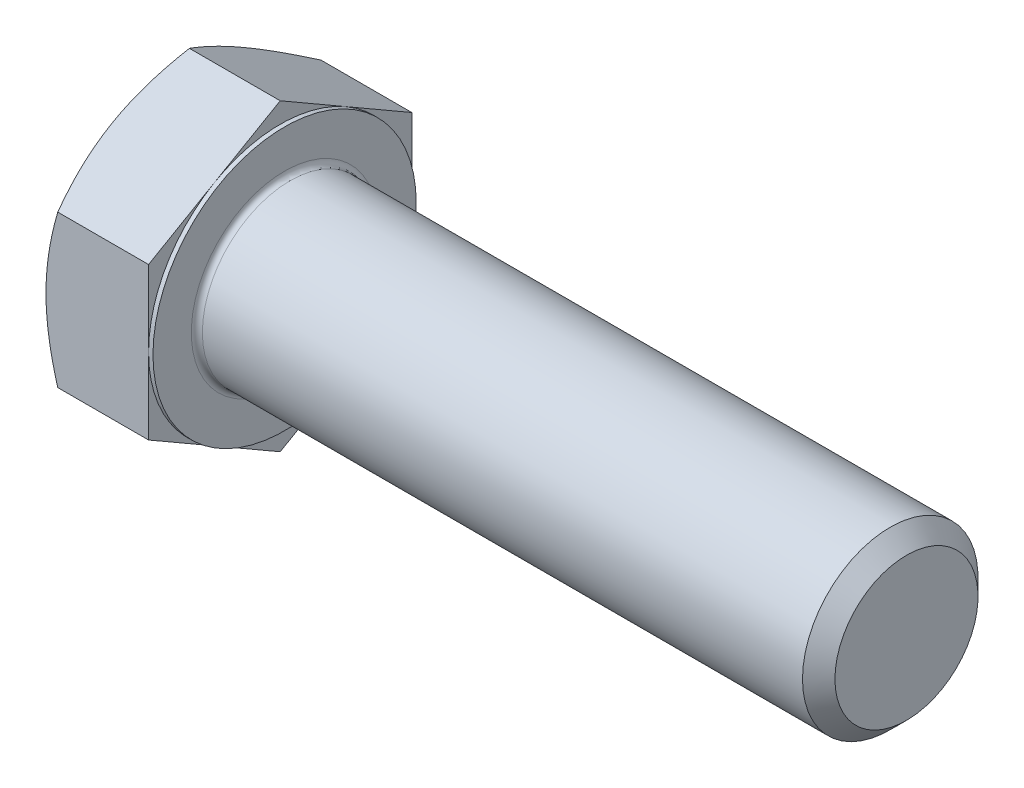
from build123d import *

# Parameters (mm, degrees)
BASEHEAD_DEPTH   = 15.478125
BEARINGFACESKE_W = 0.635
BEARINGFACESKE_H = 2.947045256
FILLET_2_R       = 0.8


with BuildPart() as part:
    # BaseHeadSke → BaseHead (new body)
    with BuildSketch(Plane(origin=(0, 0, 0), x_dir=(0, 0, -1), z_dir=(1, 0, 0))):
        Polygon((19.05, 10.998522628), (0, 21.997045256), (-19.05, 10.998522628), (-19.05, -10.998522628), (0, -21.997045256), (19.05, -10.998522628), align=None)
    extrude(amount=BASEHEAD_DEPTH)

    # BodySke → BaseBody (revolve)
    with BuildSketch(Plane.XY):
        Polygon((0, 0), (105.478125, 0), (105.478125, 10.352), (103.130125, 12.7), (0, 12.7), align=None)
    revolve(axis=Axis((0, 0, 0), (1, 0, 0)))

    # HeadChamferSke → HeadChamfer (revolve, cut)
    with BuildSketch(Plane.XY):
        Polygon((1.701477372, 21.997045256), (0, 21.997045256), (0, 19.05), align=None)
    revolve(axis=Axis((0, 0, 0), (1, 0, 0)), mode=Mode.SUBTRACT)

    # BearingFaceSke → BearingFace (revolve, cut)
    with BuildSketch(Plane.XY):
        with Locations((15.160625, 20.523522628)):
            Rectangle(BEARINGFACESKE_W, BEARINGFACESKE_H)
    revolve(axis=Axis((0, 0, 0), (1, 0, 0)), mode=Mode.SUBTRACT)

    # Fillet 2
    fillet_2_edges = [part.edges().sort_by_distance(p)[0] for p in [
        (15.478125, -12.7, 0),
    ]]
    fillet(fillet_2_edges, radius=FILLET_2_R)


solid = part.part
